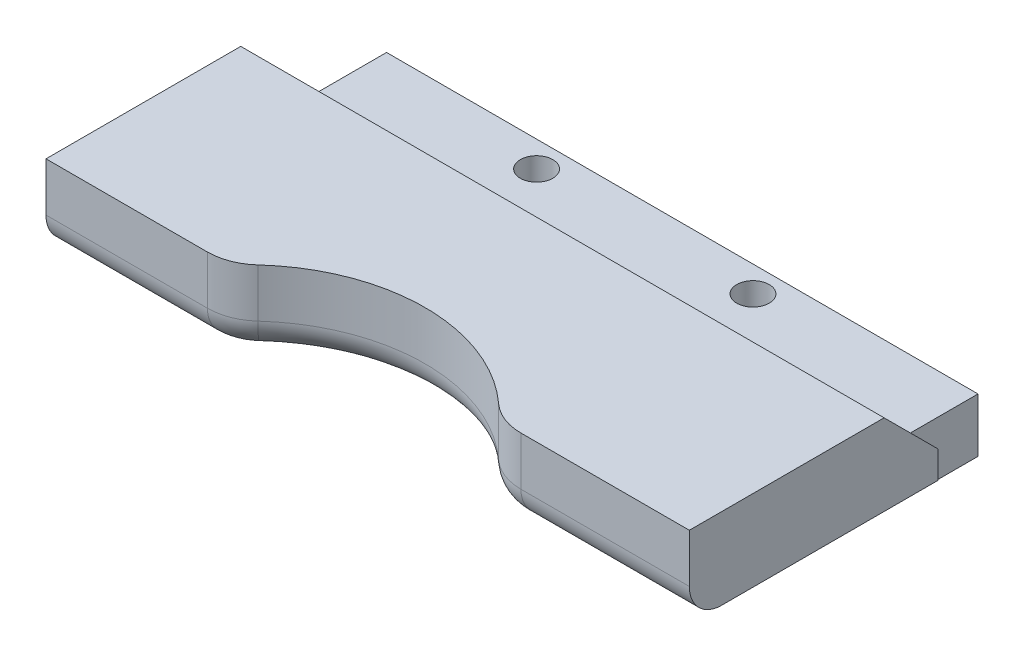
from build123d import *

# Parameters (mm, degrees)
SKETCH_1_W          = 54.664318292
SKETCH_1_H          = 5
SKETCH_1_R          = 1.5
EXTRUDE_1_DEPTH     = 5
SKETCH_2_W          = 59.460193076
SKETCH_2_H          = 2.500348526
EXTRUDE_2_DEPTH     = 23
SKETCH_5_R          = 16.5
CUT_EXTRUDE_1_DEPTH = 15
EXTRUDE_START       = 5
EXTRUDE_3_DEPTH     = 5
CHAMFER_1_SIZE      = 5
FILLET_6_R          = 10
FILLET_7_R          = 5
FILLET_8_R          = 3


with BuildPart() as part:
    # 草图1 → 凸台-拉伸1 (new body)
    with BuildSketch(Plane(origin=(0, 0, 0), x_dir=(1, 0, 0), z_dir=(0, 1, 0))):
        with Locations((1.075531559, -8.61)):
            Rectangle(SKETCH_1_W, SKETCH_1_H)
        with Locations(Location((-10, -8.5, 0), (0, 0, 270))):
            Circle(SKETCH_1_R, mode=Mode.SUBTRACT)
        with Locations(Location((10, -8.5, 0), (0, 0, 90))):
            Circle(SKETCH_1_R, mode=Mode.SUBTRACT)
    extrude(amount=EXTRUDE_1_DEPTH)

    # 草图2 → 凸台-拉伸2 (add)
    with BuildSketch(Plane.XY.offset(11.11)):
        with Locations((0, 2.5)):
            Rectangle(SKETCH_2_W, SKETCH_2_H)
    extrude(amount=EXTRUDE_2_DEPTH)

    # 草图5 → 切除-拉伸1 (cut)
    with BuildSketch(Plane(origin=(0, 3.750174263, 0), x_dir=(1, 0, 0), z_dir=(0, 1, 0))):
        with Locations((-0.32, -44.994124541)):
            Circle(SKETCH_5_R)
    extrude(amount=-CUT_EXTRUDE_1_DEPTH, mode=Mode.SUBTRACT)

    # 草图7 → 凸台-拉伸3 (add)
    with BuildSketch(Plane(origin=(0, 3.750174263, 0), x_dir=(1, 0, 0), z_dir=(0, 1, 0)).offset(EXTRUDE_START)):
        with BuildLine():
            Line((-29.730096538, -34.11), (-12.721041608, -34.11))
            ThreePointArc((-12.721041608, -34.11), (-0.32, -28.494124541), (12.081041608, -34.11))
            Line((12.081041608, -34.11), (29.730096538, -34.11))
            Line((29.730096538, -34.11), (29.730096538, -11.11))
            Line((29.730096538, -11.11), (28.407690705, -11.11))
            Line((28.407690705, -11.11), (-26.256627587, -11.11))
            Line((-26.256627587, -11.11), (-29.730096538, -11.11))
            Line((-29.730096538, -11.11), (-29.730096538, -34.11))
        make_face()
    extrude(amount=-EXTRUDE_3_DEPTH)

    # 倒角1
    # the kernel refuses this chamfer: 5 mm, written as the material it takes off along each edge
    with BuildSketch(Plane(origin=(-42.588511478, 8.750174263, 11.11), x_dir=(0, -0.9996219169112968, -0.027495876610586317), z_dir=(1, 0, 0))) as chamfer_1_piece_1_section:
        Polygon((CHAMFER_1_SIZE * 0.999621916911, -CHAMFER_1_SIZE * 0.0274958766106), (-CHAMFER_1_SIZE * 0.0274958766106, -CHAMFER_1_SIZE * 0.999621916911), (0, 0), align=None)
    chamfer_1_piece_1 = extrude(amount=85.177022955, mode=Mode.PRIVATE)
    chamfer_1_piece_1 = split(chamfer_1_piece_1, bisect_by=Plane(origin=(-34.422569532, 5, 11.399404242), z_dir=(0, -1, 0)), keep=Keep.TOP, mode=Mode.PRIVATE)
    chamfer_1_piece_1 = split(chamfer_1_piece_1, bisect_by=Plane(origin=(-26.256627587, 4.506210637, 11.399404242), z_dir=(-1, 0, 0)), keep=Keep.TOP, mode=Mode.PRIVATE)
    add(chamfer_1_piece_1, mode=Mode.SUBTRACT)
    with BuildSketch(Plane(origin=(-42.588511478, 8.750174263, 11.11), x_dir=(0, -0.9996219169112968, -0.027495876610586317), z_dir=(1, 0, 0))) as chamfer_1_piece_2_section:
        Polygon((CHAMFER_1_SIZE * 0.999621916911, -CHAMFER_1_SIZE * 0.0274958766106), (-CHAMFER_1_SIZE * 0.0274958766106, -CHAMFER_1_SIZE * 0.999621916911), (0, 0), align=None)
    chamfer_1_piece_2 = extrude(amount=85.177022955, mode=Mode.PRIVATE)
    chamfer_1_piece_2 = split(chamfer_1_piece_2, bisect_by=Plane(origin=(-34.422569532, 5, 12.869772417), z_dir=(0, 1, 0)), keep=Keep.TOP, mode=Mode.PRIVATE)
    chamfer_1_piece_2 = split(chamfer_1_piece_2, bisect_by=Plane(origin=(-26.256627587, 7.312697929, 12.869772417), z_dir=(-1, 0, 0)), keep=Keep.TOP, mode=Mode.PRIVATE)
    add(chamfer_1_piece_2, mode=Mode.SUBTRACT)
    with BuildSketch(Plane(origin=(-42.588511478, 8.750174263, 11.11), x_dir=(0, -0.9996219169112968, -0.027495876610586317), z_dir=(1, 0, 0))) as chamfer_1_piece_3_section:
        Polygon((CHAMFER_1_SIZE * 0.999621916911, -CHAMFER_1_SIZE * 0.0274958766106), (-CHAMFER_1_SIZE * 0.0274958766106, -CHAMFER_1_SIZE * 0.999621916911), (0, 0), align=None)
    chamfer_1_piece_3 = extrude(amount=85.177022955, mode=Mode.PRIVATE)
    chamfer_1_piece_3 = split(chamfer_1_piece_3, bisect_by=Plane(origin=(1.075531559, 5, 12.869772417), z_dir=(0, 1, 0)), keep=Keep.TOP, mode=Mode.PRIVATE)
    chamfer_1_piece_3 = split(chamfer_1_piece_3, bisect_by=Plane(origin=(28.407690705, 7.312697929, 12.869772417), z_dir=(-1, 0, 0)), keep=Keep.TOP, mode=Mode.PRIVATE)
    chamfer_1_piece_3 = split(chamfer_1_piece_3, bisect_by=Plane(origin=(-26.256627587, 7.312697929, 12.869772417), z_dir=(1, 0, 0)), keep=Keep.TOP, mode=Mode.PRIVATE)
    add(chamfer_1_piece_3, mode=Mode.SUBTRACT)
    with BuildSketch(Plane(origin=(-42.588511478, 8.750174263, 11.11), x_dir=(0, -0.9996219169112968, -0.027495876610586317), z_dir=(1, 0, 0))) as chamfer_1_piece_4_section:
        Polygon((CHAMFER_1_SIZE * 0.999621916911, -CHAMFER_1_SIZE * 0.0274958766106), (-CHAMFER_1_SIZE * 0.0274958766106, -CHAMFER_1_SIZE * 0.999621916911), (0, 0), align=None)
    chamfer_1_piece_4 = extrude(amount=85.177022955, mode=Mode.PRIVATE)
    chamfer_1_piece_4 = split(chamfer_1_piece_4, bisect_by=Plane(origin=(35.498101091, 5, 11.399404242), z_dir=(0, -1, 0)), keep=Keep.TOP, mode=Mode.PRIVATE)
    chamfer_1_piece_4 = split(chamfer_1_piece_4, bisect_by=Plane(origin=(28.407690705, 4.506210637, 11.399404242), z_dir=(1, 0, 0)), keep=Keep.TOP, mode=Mode.PRIVATE)
    add(chamfer_1_piece_4, mode=Mode.SUBTRACT)
    with BuildSketch(Plane(origin=(-42.588511478, 8.750174263, 11.11), x_dir=(0, -0.9996219169112968, -0.027495876610586317), z_dir=(1, 0, 0))) as chamfer_1_piece_5_section:
        Polygon((CHAMFER_1_SIZE * 0.999621916911, -CHAMFER_1_SIZE * 0.0274958766106), (-CHAMFER_1_SIZE * 0.0274958766106, -CHAMFER_1_SIZE * 0.999621916911), (0, 0), align=None)
    chamfer_1_piece_5 = extrude(amount=85.177022955, mode=Mode.PRIVATE)
    chamfer_1_piece_5 = split(chamfer_1_piece_5, bisect_by=Plane(origin=(35.498101091, 5, 12.869772417), z_dir=(0, 1, 0)), keep=Keep.TOP, mode=Mode.PRIVATE)
    chamfer_1_piece_5 = split(chamfer_1_piece_5, bisect_by=Plane(origin=(28.407690705, 7.312697929, 12.869772417), z_dir=(1, 0, 0)), keep=Keep.TOP, mode=Mode.PRIVATE)
    add(chamfer_1_piece_5, mode=Mode.SUBTRACT)

    # 圆角6
    # the kernel refuses this fillet: 10 mm, written as the material it adds along each edge
    with BuildSketch(Plane(origin=(28.407690705, 1.249825737, 11.11), x_dir=(0, 0, 1), z_dir=(-1, 0, 0))) as fillet_6_piece_1:
        with BuildLine():
            CenterArc((4.840914208, -10), FILLET_6_R, 90, 28.952961909)
            Line((0, -1.249825737), (0, 0))
            Line((0, 0), (4.840914208, 0))
        make_face()
    extrude(amount=54.664318292)

    # 圆角7
    fillet_7_edges = [part.edges().sort_by_distance(p)[0] for p in [
        (-12.721041608, 5, 34.11),
        (12.081041608, 5, 34.11),
    ]]
    fillet(fillet_7_edges, radius=FILLET_7_R)

    # 圆角8
    fillet_8_edges = [part.edges().sort_by_distance(p)[0] for p in [
        (-0.32, 1.249825737, 28.494124541),
        (21.949780623, 1.249825737, 34.11),
        (-13.002521469, 1.249825737, 33.772076375),
        (12.362521469, 1.249825737, 33.772076375),
        (-22.269780623, 1.249825737, 34.11),
    ]]
    fillet(fillet_8_edges, radius=FILLET_8_R)


solid = part.part
